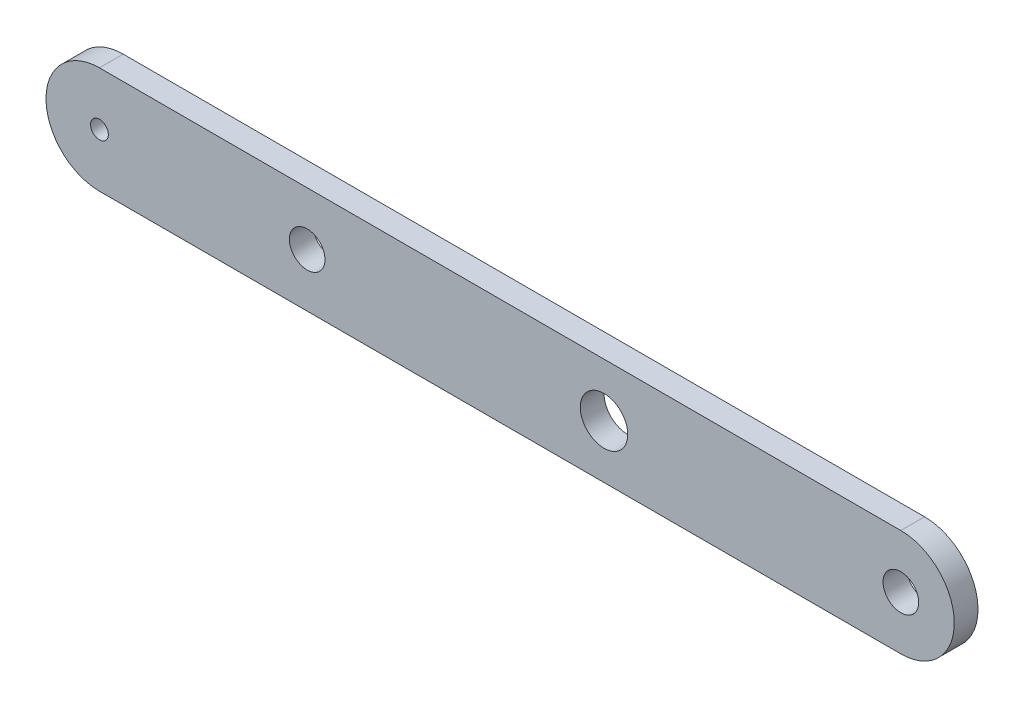
from build123d import *

# Parameters (mm, degrees)
SKETCH_1_R      = 3
SKETCH_1_R_2    = 1.5
SKETCH_1_R_3    = 4
EXTRUDE_1_DEPTH = 4


with BuildPart() as part:
    # ｽｹｯﾁ1 → ﾎﾞｽ - 押し出し1 (new body)
    with BuildSketch(Plane.XY):
        with BuildLine():
            Line((-35, 9), (100, 9))
            ThreePointArc((100, 9), (109, 0), (100, -9))
            Line((100, -9), (-35, -9))
            ThreePointArc((-35, -9), (-44, 0), (-35, 9))
        make_face()
        with Locations((100, 0)):
            Circle(SKETCH_1_R, mode=Mode.SUBTRACT)
        Circle(SKETCH_1_R, mode=Mode.SUBTRACT)
        with Locations((-35, 0)):
            Circle(SKETCH_1_R_2, mode=Mode.SUBTRACT)
        with Locations((50, 0)):
            Circle(SKETCH_1_R_3, mode=Mode.SUBTRACT)
    extrude(amount=EXTRUDE_1_DEPTH)


solid = part.part
